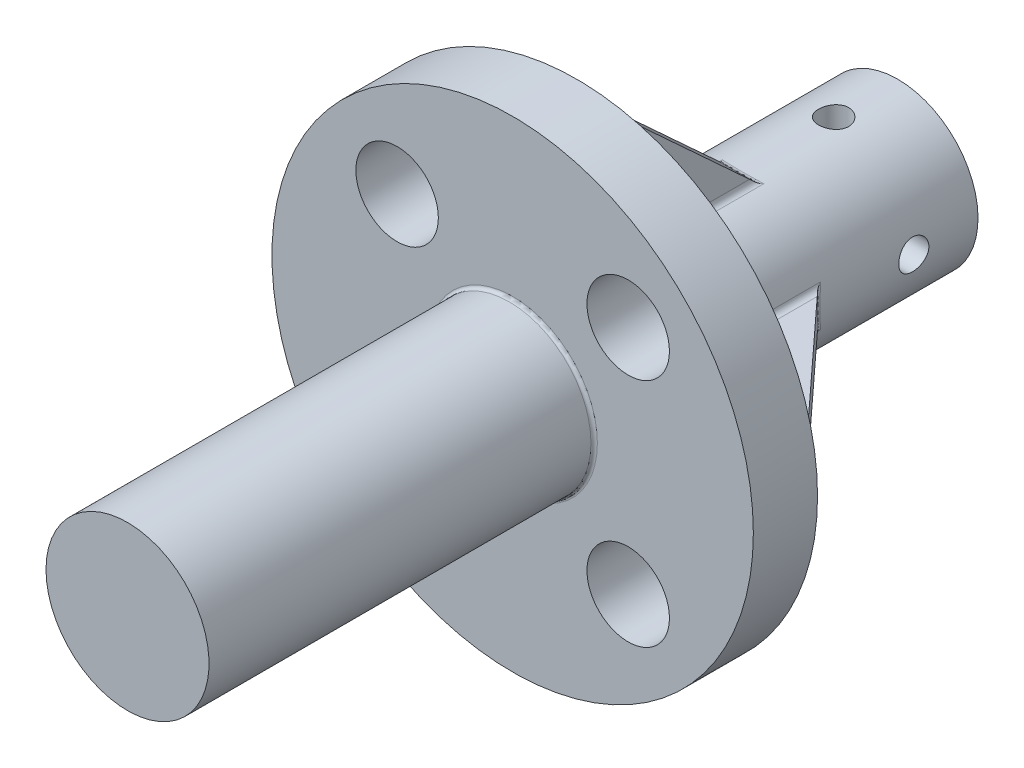
from build123d import *

# Parameters (mm, degrees)
SKETCH1_R                        = 9.525
BOSS_EXTRUDE1_DEPTH              = 2.54
SKETCH2_R                        = 3.175
BOSS_EXTRUDE2_DEPTH              = 12.7
FILLET1_R                        = 0.635
RIB1_START                       = -0.635
RIB1_DEPTH                       = 1.27
CIRPATTERN1_COUNT                = 4
FILLET2_R                        = 0.254
SKETCH6_R                        = 3.2258
BOSS_EXTRUDE3_DEPTH              = 15.24
FILLET3_R                        = 0.127
F_47_0_0785_DIAMETER_HOLE1_D     = 1.9939
F_47_0_0785_DIAMETER_HOLE1_DEPTH = 7.62
F_47_0_0785_DIAMETER_HOLE1_TIP   = 0.599027994
F_0_80_TAPPED_HOLE1_REACH        = 34.135
F_0_80_TAPPED_HOLE1_BORE_R       = 0.59563
CIRPATTERN2_COUNT                = 4
F_30_0_1285_DIAMETER_HOLE1_D     = 3.2639
CIRPATTERN3_COUNT                = 4


# Read off the part's stored shape, not the designer's step: Rib1
with BuildPart() as part:
    # Sketch1 → Boss-Extrude1 (new body)
    with BuildSketch(Plane.XY):
        Circle(SKETCH1_R)
    extrude(amount=BOSS_EXTRUDE1_DEPTH)

    # Sketch2 → Boss-Extrude2 (add)
    with BuildSketch(Plane(origin=(0, 0, 0), x_dir=(-1, 0, 0), z_dir=(0, 0, -1))):
        with Locations(Location((0, 0, 0), (0, 0, 180))):
            Circle(SKETCH2_R)
    extrude(amount=BOSS_EXTRUDE2_DEPTH)

    # Fillet1
    fillet1_edges = [part.edges().sort_by_distance(p)[0] for p in [
        (-3.175, 0, 0),
    ]]
    fillet(fillet1_edges, radius=FILLET1_R)

    # Rib1 outline → Rib1 (add)
    with BuildSketch(Plane(origin=(0, 0, 0), x_dir=(1, 0, 0), z_dir=(0, 1, 0)).offset(RIB1_START)):
        Polygon((-2, 7.627173913), (-3.110851973, 6.419726116), (-9.017, 0), (-2, 0), align=None)
    rib1 = extrude(amount=RIB1_DEPTH)

    # CirPattern1: Rib1 ×4 about axis
    cirpattern1_axis = Axis((0, 0, 0), (0, 0, 1))
    for i in range(1, CIRPATTERN1_COUNT):
        add(rib1.rotate(cirpattern1_axis, i * 360 / CIRPATTERN1_COUNT))

    # Fillet2
    fillet2_edges = [part.edges().sort_by_distance(p)[0] for p in [
        (0, -9.017, 0),
        (0, -3.175, -6.35),
        (0.635, -3.110851973, -3.527363058),
        (0.635, -6.386855331, 0),
        (0.635, -3.110851973, -3.527363058),
        (-0.635, -3.110851973, -3.527363058),
        (-0.635, -3.110851973, -3.527363058),
        (-0.635, -6.386855331, 0),
        (-6.386855331, -0.635, 0),
        (-6.386855331, 0.635, 0),
        (-9.017, 0, 0),
        (-3.175, 0, -6.35),
        (-6.386855331, -0.635, 0),
        (-3.110851973, -0.635, -3.527362758),
        (-6.386855331, 0.635, 0),
        (-3.110851973, 0.635, -3.527362758),
        (-0.635, 6.386855331, 0),
        (0.635, 6.386855331, 0),
        (0, 9.017, 0),
        (0, 3.175, -6.35),
        (-0.635, 6.386855331, 0),
        (-0.635, 3.110851973, -3.527363058),
        (0.635, 3.110851973, -3.527363058),
        (0.635, 6.386855331, 0),
        (9.017, 0, 0),
        (3.158734089, -0.320973449, -6.367680338),
        (6.386855331, 0.635, 0),
        (6.386855331, 0.635, 0),
        (3.110851973, 0.635, -3.527363058),
        (3.110851973, -0.635, -3.527363058),
        (6.386855331, -0.635, 0),
        (6.386855331, -0.635, 0),
    ]]
    fillet(fillet2_edges, radius=FILLET2_R)

    # Sketch6 → Boss-Extrude3 (add)
    with BuildSketch(Plane.XY.offset(2.54)):
        with Locations(Location((0, 0, 0), (0, 0, 180))):
            Circle(SKETCH6_R)
    extrude(amount=BOSS_EXTRUDE3_DEPTH)

    # Fillet3
    fillet3_edges = [part.edges().sort_by_distance(p)[0] for p in [
        (3.2258, 0, 2.54),
    ]]
    fillet(fillet3_edges, radius=FILLET3_R)

    # #47 (0.0785) Diameter Hole1
    with Locations(Plane(origin=(0, 0, -12.7), x_dir=(-1, 0, 0), z_dir=(0, 0, -1))):
        with Locations((0, 0)):
            Hole(F_47_0_0785_DIAMETER_HOLE1_D / 2, depth=F_47_0_0785_DIAMETER_HOLE1_DEPTH)
            with Locations((0, 0, -(F_47_0_0785_DIAMETER_HOLE1_DEPTH + F_47_0_0785_DIAMETER_HOLE1_TIP / 2))):  # 118° drill point
                Cone(0, F_47_0_0785_DIAMETER_HOLE1_D / 2, F_47_0_0785_DIAMETER_HOLE1_TIP, mode=Mode.SUBTRACT)

    # #0-80 Tapped Hole1 bore (on position points) → #0-80 Tapped Hole1 (cut, up to next)
    with BuildSketch(Plane(origin=(-3.175, 0, -10.16), x_dir=(0, -1, 0), z_dir=(-1, 0, 0)), mode=Mode.PRIVATE) as f_0_80_tapped_hole1_sk1:
        Circle(F_0_80_TAPPED_HOLE1_BORE_R)
    f_0_80_tapped_hole1_tool1 = extrude(f_0_80_tapped_hole1_sk1.sketch, amount=-F_0_80_TAPPED_HOLE1_REACH, mode=Mode.PRIVATE) & part.part
    f_0_80_tapped_hole1 = f_0_80_tapped_hole1_tool1.solids().sort_by_distance((-3.175, 0, -10.16))[0]
    add(f_0_80_tapped_hole1, mode=Mode.SUBTRACT)

    # CirPattern2: #0-80 Tapped Hole1 ×4 about axis
    cirpattern2_axis = Axis((0, 0, -12.7), (0, 0, 1))
    for i in range(1, CIRPATTERN2_COUNT):
        add(f_0_80_tapped_hole1.rotate(cirpattern2_axis, i * 360 / CIRPATTERN2_COUNT), mode=Mode.SUBTRACT)

    # #30 (0.1285) Diameter Hole1 (through all)
    with Locations(Plane(origin=(0, 0, 0), x_dir=(-1, 0, 0), z_dir=(0, 0, -1))):
        with Locations((-4.572, -4.572)):
            f_30_0_1285_diameter_hole1 = Hole(F_30_0_1285_DIAMETER_HOLE1_D / 2)

    # CirPattern3: #30 (0.1285) Diameter Hole1 ×4 about axis
    cirpattern3_axis = Axis((0, 0, 0), (0, 0, 1))
    for i in range(1, CIRPATTERN3_COUNT):
        add(f_30_0_1285_diameter_hole1.rotate(cirpattern3_axis, i * 360 / CIRPATTERN3_COUNT), mode=Mode.SUBTRACT)


solid = part.part
